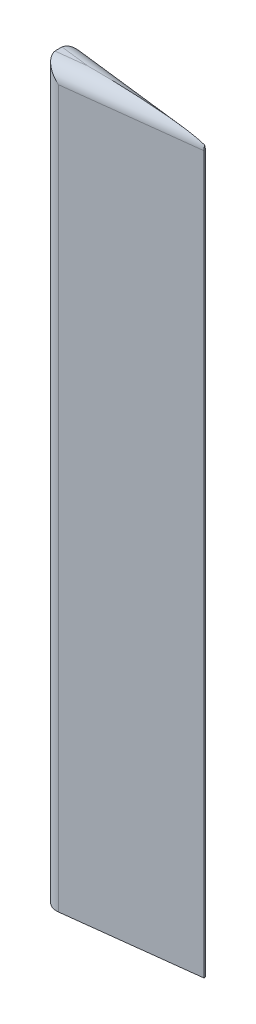
from build123d import *

# Parameters (mm, degrees)
SKETCH1_W               = 20
SKETCH1_H               = 100
BOSS_EXTRUDE1_DEPTH     = 5
CUT_EXTRUDE1_DEPTH      = 103.102889283
CUT_EXTRUDE1_DEPTH_BACK = 103.102889283
FILLET1_R               = 2


with BuildPart() as part:
    # Sketch1 → Boss-Extrude1 (new body)
    with BuildSketch(Plane.XY):
        with Locations((10, 50)):
            Rectangle(SKETCH1_W, SKETCH1_H)
    extrude(amount=BOSS_EXTRUDE1_DEPTH)

    # Sketch2 → Cut-Extrude1 (cut, two sides: drawn at the far end of the back side and taken through both)
    with BuildSketch(Plane(origin=(0, 0, 0), x_dir=(1, 0, 0), z_dir=(0, 1, 0)).offset(-CUT_EXTRUDE1_DEPTH_BACK)):
        Polygon((0, 0), (20, -2.4), (20, 0), align=None)
        Polygon((0, -5), (20, -2.6), (20, -5), align=None)
    extrude(amount=CUT_EXTRUDE1_DEPTH + CUT_EXTRUDE1_DEPTH_BACK, mode=Mode.SUBTRACT)

    # Fillet1
    # the kernel refuses this fillet: 2 mm, written as the material it takes off along each edge
    with BuildSketch(Plane(origin=(0, -5.635871325, 0), x_dir=(0, 0, 1), z_dir=(0, 1, 0))) as fillet1_piece_1:
        with BuildLine():
            CenterArc((FILLET1_R * 1.12717426496, FILLET1_R), FILLET1_R, 173.157226587, 96.842773413)
            Line((FILLET1_R * 0.134297426474, FILLET1_R * 1.11914522062), (0, 0))
            Line((0, 0), (FILLET1_R * 1.12717426496, 0))
        make_face()
    extrude(amount=111.27174265, mode=Mode.SUBTRACT)
    with BuildSketch(Plane(origin=(0, -5.635871325, 5), x_dir=(0, 0, -1), z_dir=(0, 1, 0))) as fillet1_piece_2:
        with BuildLine():
            CenterArc((FILLET1_R * 1.12717426496, -FILLET1_R), FILLET1_R, 90, 96.842773413)
            Line((FILLET1_R * 0.134297426474, -FILLET1_R * 1.11914522062), (0, 0))
            Line((0, 0), (FILLET1_R * 1.12717426496, 0))
        make_face()
    extrude(amount=111.27174265, mode=Mode.SUBTRACT)
    with BuildSketch(Plane(origin=(24.964384192, 100, 2.995726103), x_dir=(-0.11914522061843055, 0, 0.9928768384869221), z_dir=(-0.9928768384869221, 0, -0.11914522061843054))) as fillet1_piece_3:
        with BuildLine():
            CenterArc((FILLET1_R, -FILLET1_R), FILLET1_R, 90, 90)
            Line((0, -FILLET1_R), (0, 0))
            Line((0, 0), (FILLET1_R, 0))
        make_face()
    extrude(amount=30.143485299, mode=Mode.SUBTRACT)
    with BuildSketch(Plane(origin=(24.964384192, 100, 2.004273897), x_dir=(-0.11914522061843079, 0, -0.9928768384869221), z_dir=(-0.9928768384869221, 0, 0.11914522061843079))) as fillet1_piece_4:
        with BuildLine():
            CenterArc((FILLET1_R, FILLET1_R), FILLET1_R, 180, 90)
            Line((0, FILLET1_R), (0, 0))
            Line((0, 0), (FILLET1_R, 0))
        make_face()
    extrude(amount=30.143485299, mode=Mode.SUBTRACT)


solid = part.part
